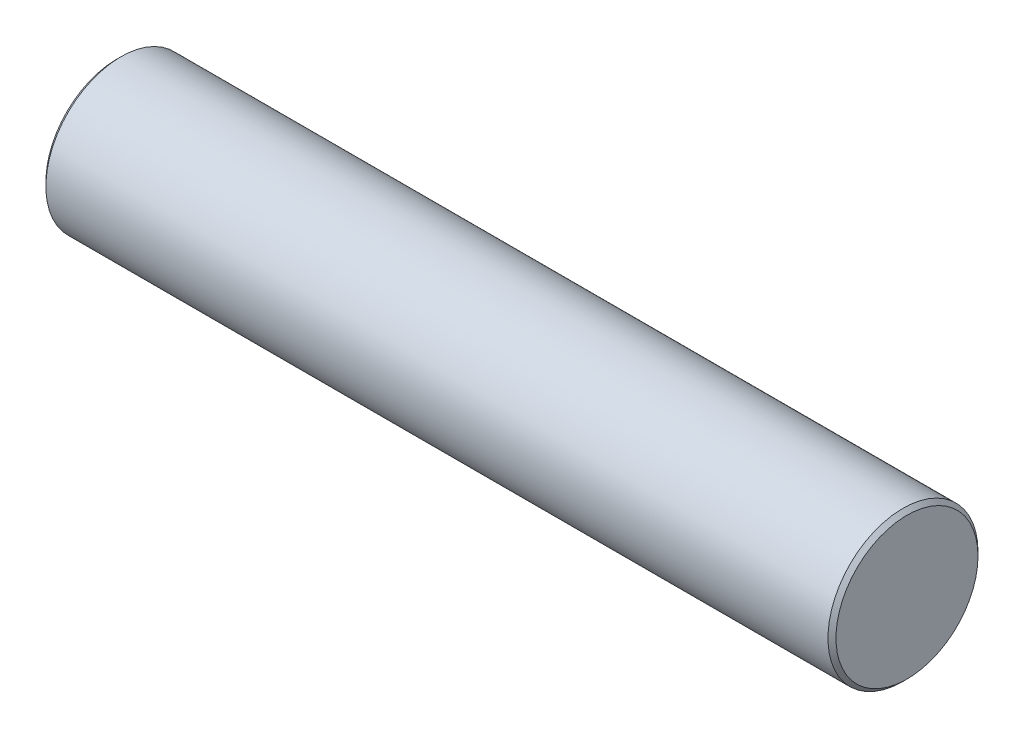
from build123d import *

# Parameters (mm, degrees)
SKETCH1_R           = 7.5
BOSS_EXTRUDE1_DEPTH = 39.5
CHAMFER1_SIZE       = 0.4


with BuildPart() as part:
    # Sketch1 → Boss-Extrude1 (new, symmetric)
    with BuildSketch(Plane(origin=(0, 0, 0), x_dir=(0, 0, -1), z_dir=(1, 0, 0))):
        Circle(SKETCH1_R)
    extrude(amount=BOSS_EXTRUDE1_DEPTH, both=True)

    # Chamfer1
    chamfer1_edges = [part.edges().sort_by_distance(p)[0] for p in [
        (39.5, 0, 7.5),
        (-39.5, 0, 7.5),
    ]]
    chamfer(chamfer1_edges, length=CHAMFER1_SIZE)


solid = part.part
